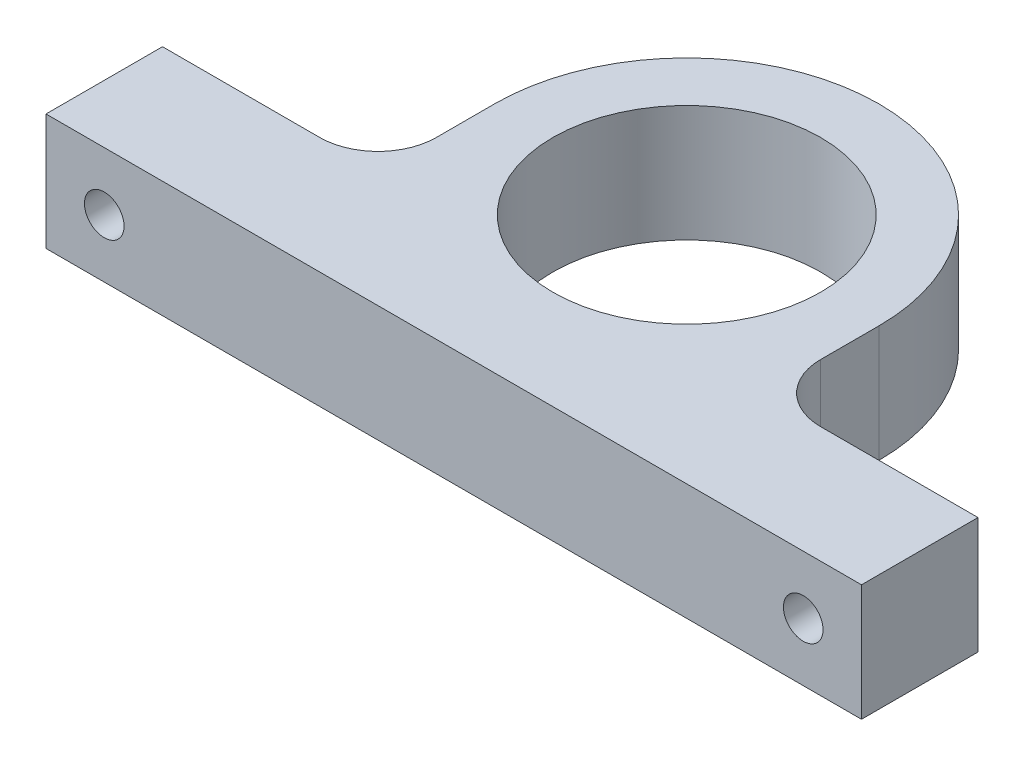
from build123d import *

# Parameters (mm, degrees)
SKETCH1_R                                       = 11.5
BOSS_EXTRUDE1_DEPTH                             = 10
FILLET1_R                                       = 5
CSK_FOR_M3_FLAT_HEAD_MACHINE_SCREW1_D           = 3.4
CSK_FOR_M3_FLAT_HEAD_MACHINE_SCREW1_CSINK_D     = 6.3
CSK_FOR_M3_FLAT_HEAD_MACHINE_SCREW1_CSINK_ANGLE = 90


with BuildPart() as part:
    # Sketch1 → Boss-Extrude1 (new body)
    with BuildSketch(Plane(origin=(0, 0, 0), x_dir=(1, 0, 0), z_dir=(0, 1, 0))):
        with BuildLine():
            Line((35, 0), (-35, 0))
            Line((-35, 0), (-35, 10))
            Line((-35, 10), (-16.5, 10))
            Line((-16.5, 10), (-16.5, 20))
            ThreePointArc((-16.5, 20), (0, 36.5), (16.5, 20))
            Line((16.5, 20), (16.5, 10))
            Line((16.5, 10), (35, 10))
            Line((35, 10), (35, 0))
        make_face()
        with Locations((0, 20)):
            Circle(SKETCH1_R, mode=Mode.SUBTRACT)
    extrude(amount=BOSS_EXTRUDE1_DEPTH)

    # Fillet1
    fillet1_edges = [part.edges().sort_by_distance(p)[0] for p in [
        (-16.5, 5, -10),
        (16.5, 5, -10),
    ]]
    fillet(fillet1_edges, radius=FILLET1_R)

    # CSK for M3 Flat Head Machine Screw1 (through all)
    with Locations(Plane(origin=(30, 5, -10), x_dir=(-1, 0, 0), z_dir=(0, 0, -1))):
        with Locations((0, 0), (60, 0)):
            CounterSinkHole(CSK_FOR_M3_FLAT_HEAD_MACHINE_SCREW1_D / 2, CSK_FOR_M3_FLAT_HEAD_MACHINE_SCREW1_CSINK_D / 2, counter_sink_angle=CSK_FOR_M3_FLAT_HEAD_MACHINE_SCREW1_CSINK_ANGLE)


solid = part.part
